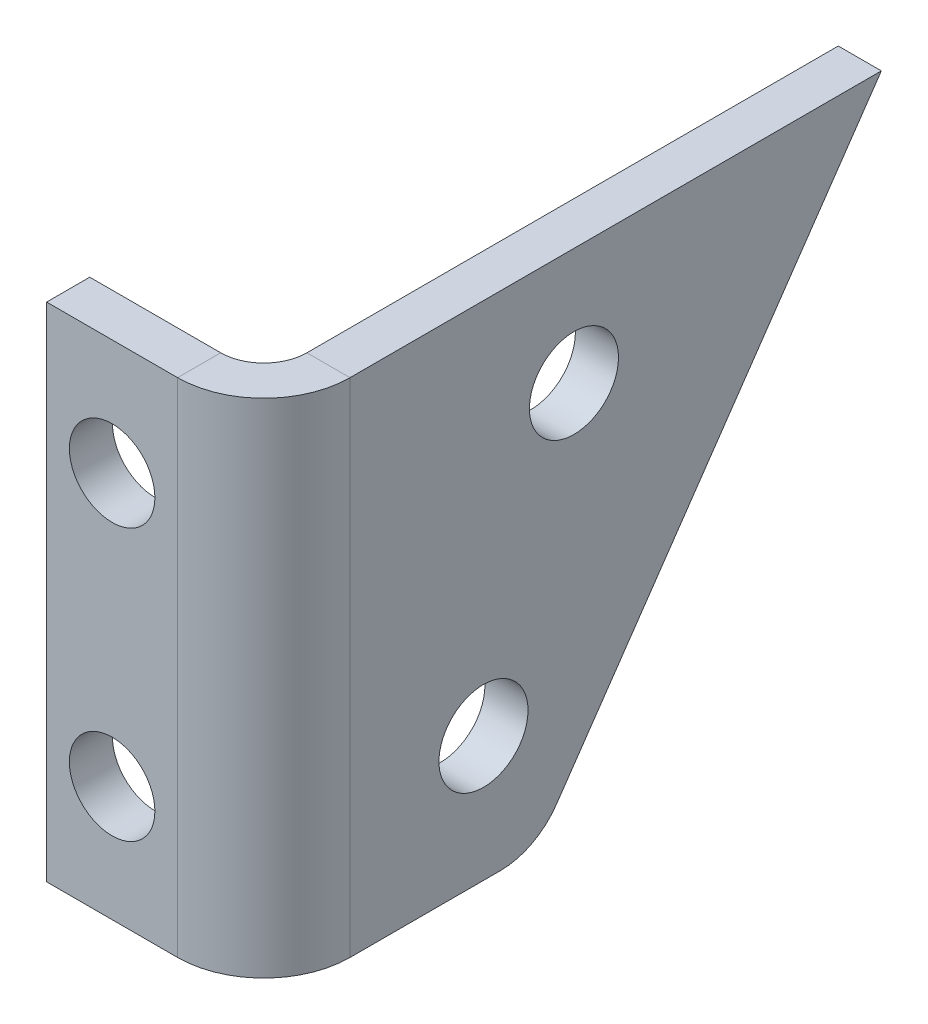
from build123d import *

# Parameters (mm, degrees)
SKETCH2_R                    = 3.282457618
BASE_FLANGE1_DEPTH           = 3.175
EDGE_FLANGE1_STRIP_W         = 19.05
EDGE_FLANGE1_STRIP_H         = 3.175
EDGE_FLANGE1_STRIP_CUT_DEPTH = 37
EDGE_FLANGE1_DEPTH           = 37
SKETCH6_R                    = 3.15
CUT_EXTRUDE1_DEPTH           = 10


# Sheet-metal steps are written as plain solids
with BuildPart() as part:
    # Sketch2 → Base-Flange1 (new body)
    with BuildSketch(Plane(origin=(0, 0, 0), x_dir=(0, 0, -1), z_dir=(1, 0, 0))):
        with BuildLine():
            Line((50.159054546, 37), (50.159054546, 0))
            Line((50.159054546, 0), (67.597909272, 0))
            ThreePointArc((67.597909272, 0), (69.925870777, 0.575003364), (71.718398003, 2.167761907))
            Line((71.718398003, 2.167761907), (95.660507303, 37))
            Line((95.660507303, 37), (50.159054546, 37))
        make_face()
        with Locations((73.009854993, 28.405566411)):
            Circle(SKETCH2_R, mode=Mode.SUBTRACT)
        with Locations((66.344990455, 9.222294526)):
            Circle(SKETCH2_R, mode=Mode.SUBTRACT)
    extrude(amount=-BASE_FLANGE1_DEPTH)

    # Edge-Flange1 strip (across the edge) → Edge-Flange1 strip cut (cut)
    with BuildSketch(Plane(origin=(-3.175, 0, -50.159054546), x_dir=(0, 0, -1), z_dir=(0, 1, 0))):
        with Locations((-3.175, -1.5875)):
            Rectangle(EDGE_FLANGE1_STRIP_W, EDGE_FLANGE1_STRIP_H)
    extrude(amount=EDGE_FLANGE1_STRIP_CUT_DEPTH, mode=Mode.SUBTRACT)

    # Edge-Flange1 section (across the edge) → Edge-Flange1 (add)
    with BuildSketch(Plane(origin=(-3.175, 0, -50.159054546), x_dir=(0, 0, -1), z_dir=(0, 1, 0))):
        with BuildLine():
            Line((0, 3.175), (0, 12.825))
            Line((0, 12.825), (3.175, 12.825))
            Line((3.175, 12.825), (3.175, 3.175))
            ThreePointArc((3.175, 3.175), (4.10493597, 0.92993597), (6.35, 0))
            Line((6.35, 0), (6.35, -3.175))
            ThreePointArc((6.35, -3.175), (1.859871939, -1.315128061), (0, 3.175))
        make_face()
    extrude(amount=EDGE_FLANGE1_DEPTH)

    # Sketch6 → Cut-Extrude1 (cut)
    with BuildSketch(Plane(origin=(0, 0, -53.334054546), x_dir=(-1, 0, 0), z_dir=(0, 0, -1))):
        with Locations((11.175, 28.5)):
            Circle(SKETCH6_R)
        with Locations((11.175, 8.5)):
            Circle(SKETCH6_R)
    extrude(amount=-CUT_EXTRUDE1_DEPTH, mode=Mode.SUBTRACT)


solid = part.part
